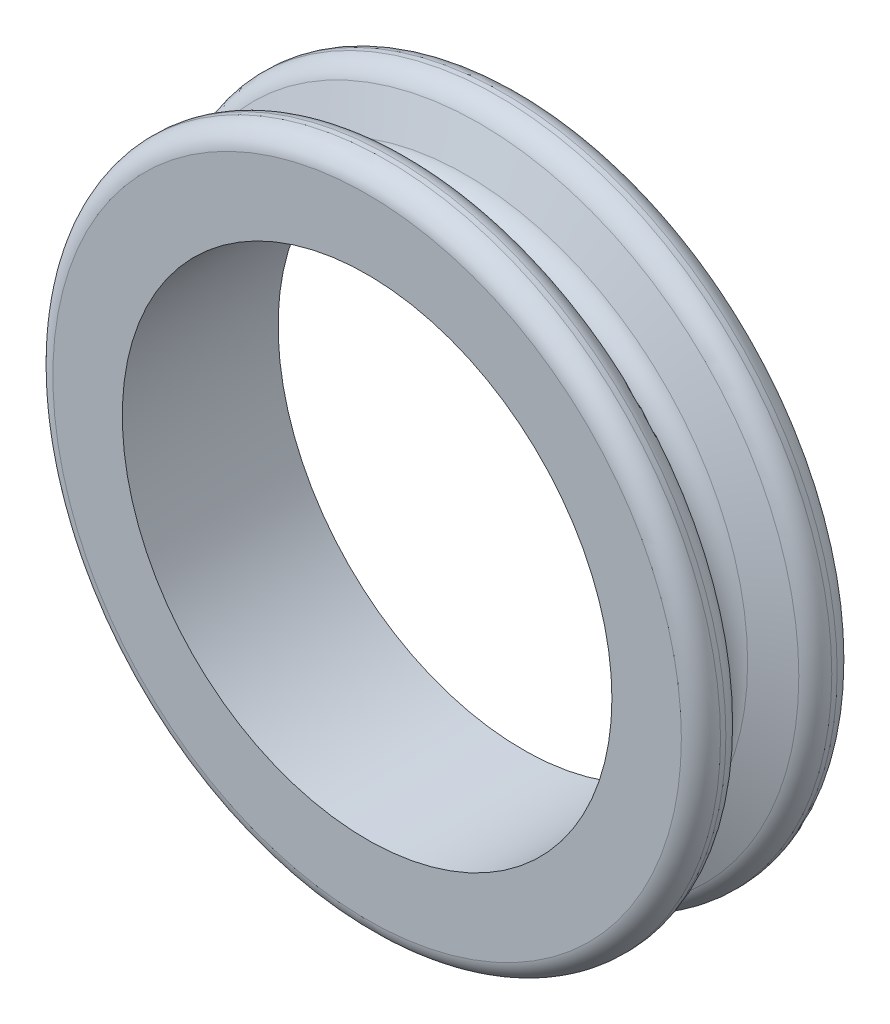
from build123d import *

# Parameters (mm, degrees)
BOSS_EXTRUDE1_DEPTH      = 3.5
BOSS_EXTRUDE1_DEPTH_BACK = 3.5
SKETCH1_R                = 15
SKETCH1_R_2              = 11


# Read off the part's stored shape, not the designer's step: Cut-Revolve2
with BuildPart() as part:
    # Sketch1 → Boss-Extrude1 (new, two sides: drawn at the far end of the back side and taken through both)
    with BuildSketch(Plane.XY.offset(-BOSS_EXTRUDE1_DEPTH_BACK)):
        Circle(SKETCH1_R)
        Circle(SKETCH1_R_2, mode=Mode.SUBTRACT)
    extrude(amount=BOSS_EXTRUDE1_DEPTH + BOSS_EXTRUDE1_DEPTH_BACK)

    # Cut-Revolve2 outline → Cut-Revolve2 (revolve, cut)
    with BuildSketch(Plane.XZ):
        with BuildLine():
            ThreePointArc((14.120311353, 3.5), (14.712206017, 3.212206017), (15, 2.620311353))
            Line((15, 2.620311353), (15, 3.5))
            Line((15, 3.5), (14.120311353, 3.5))
        make_face()
        with BuildLine():
            Line((15, -2.379688647), (15, 2.379688647))
            ThreePointArc((15, 2.379688647), (14.789015345, 1.873957185), (14.34448659, 1.553530872))
            Line((14.34448659, 1.553530872), (12.657979857, 0.939692621))
            ThreePointArc((12.657979857, 0.939692621), (12, 0), (12.657979857, -0.939692621))
            Line((12.657979857, -0.939692621), (14.34448659, -1.553530872))
            ThreePointArc((14.34448659, -1.553530872), (14.789015345, -1.873957185), (15, -2.379688647))
        make_face()
        with BuildLine():
            Line((15, -3.5), (15, -2.620311353))
            ThreePointArc((15, -2.620311353), (14.712206017, -3.212206017), (14.120311353, -3.5))
            Line((14.120311353, -3.5), (15, -3.5))
        make_face()
    revolve(axis=Axis((0, 0, 0), (0, 0, 1)), mode=Mode.SUBTRACT)


solid = part.part
